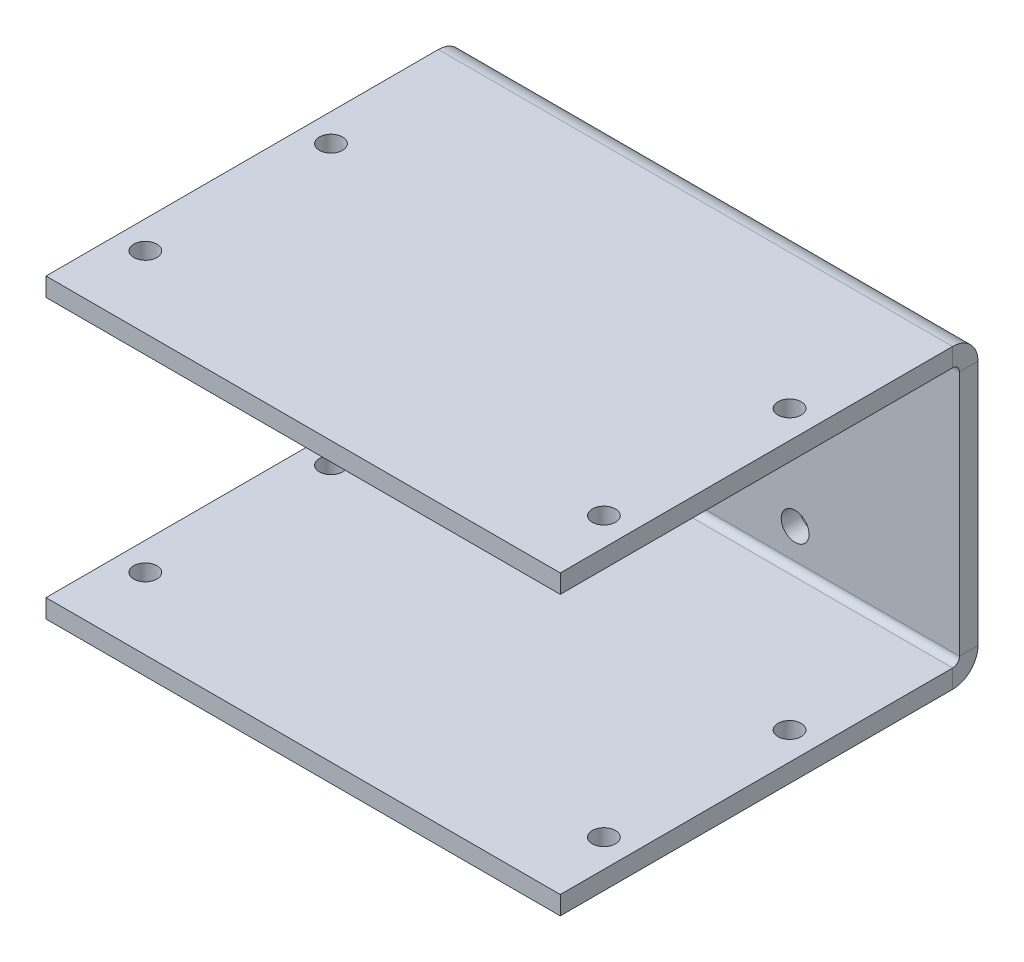
from build123d import *

# Parameters (mm, degrees)
SZKIC1_W                             = 55.4
SZKIC1_H                             = 28
ODGI_CIE_BAZOWE1_DEPTH               = 2
OTWORY_USTALAJ_CE_3_0MM1_D           = 3
OTWORY_USTALAJ_CE_3_0MM1_DEPTH       = 17
OTWORY_USTALAJ_CE_3_0MM1_TIP         = 0.901290929
ODGI_CIE_KRAW_DZI1_STRIP_W           = 9.4732
ODGI_CIE_KRAW_DZI1_STRIP_H           = 2
ODGI_CIE_KRAW_DZI1_STRIP_CUT_DEPTH   = 55.4
ODGI_CIE_KRAW_DZI1_STRIP_2_W         = 9.4732
ODGI_CIE_KRAW_DZI1_STRIP_2_H         = 2
ODGI_CIE_KRAW_DZI1_STRIP_CUT_2_DEPTH = 55.4
ODGI_CIE_KRAW_DZI1_DEPTH             = 55.4
ODGI_CIE_KRAW_DZI1_BEND_DEPTH        = 55.4
OTW_R_GWINTOWANY_M3X0_51_D           = 2.5


# Sheet-metal steps are written as plain solids
with BuildPart() as part:
    # Szkic1 → Odgięcie bazowe1 (new body)
    with BuildSketch(Plane.XY):
        Rectangle(SZKIC1_W, SZKIC1_H)
    extrude(amount=-ODGI_CIE_BAZOWE1_DEPTH)

    # Otwory ustalające Ø3.0mm1
    with Locations(Plane(origin=(0, 0, -2), x_dir=(-1, 0, 0), z_dir=(0, 0, -1))):
        with Locations((-10, 10), (10, 10), (10, -10), (-10, -10)):
            Hole(OTWORY_USTALAJ_CE_3_0MM1_D / 2, depth=OTWORY_USTALAJ_CE_3_0MM1_DEPTH)
            with Locations((0, 0, -(OTWORY_USTALAJ_CE_3_0MM1_DEPTH + OTWORY_USTALAJ_CE_3_0MM1_TIP / 2))):  # 118° drill point
                Cone(0, OTWORY_USTALAJ_CE_3_0MM1_D / 2, OTWORY_USTALAJ_CE_3_0MM1_TIP, mode=Mode.SUBTRACT)

    # Odgięcie krawędzi1 strip (across the edge) → Odgięcie krawędzi1 strip cut (cut)
    with BuildSketch(Plane(origin=(27.7, 14, 0), x_dir=(0, -1, 0), z_dir=(-1, 0, 0))):
        with Locations((-4, -1)):
            Rectangle(ODGI_CIE_KRAW_DZI1_STRIP_W, ODGI_CIE_KRAW_DZI1_STRIP_H)
    extrude(amount=ODGI_CIE_KRAW_DZI1_STRIP_CUT_DEPTH, mode=Mode.SUBTRACT)

    # Odgięcie krawędzi1 strip 2 (across the edge) → Odgięcie krawędzi1 strip cut 2 (cut)
    with BuildSketch(Plane(origin=(-27.7, -14, 0), x_dir=(0, 1, 0), z_dir=(1, 0, 0))):
        with Locations((-4, -1)):
            Rectangle(ODGI_CIE_KRAW_DZI1_STRIP_2_W, ODGI_CIE_KRAW_DZI1_STRIP_2_H)
    extrude(amount=ODGI_CIE_KRAW_DZI1_STRIP_CUT_2_DEPTH, mode=Mode.SUBTRACT)

    # Odgięcie krawędzi1 section (across the edge) → Odgięcie krawędzi1 (add)
    with BuildSketch(Plane(origin=(27.7, 14, 0), x_dir=(0, -1, 0), z_dir=(-1, 0, 0))):
        with BuildLine():
            Line((-2, 0.7366), (-2, 43))
            Line((-2, 43), (0, 43))
            Line((0, 43), (0, 0.7366))
            ThreePointArc((0, 0.7366), (0.215745145, 0.215745145), (0.7366, 0))
            Line((0.7366, 0), (0.7366, -2))
            ThreePointArc((0.7366, -2), (-1.198468417, -1.198468417), (-2, 0.7366))
        make_face()
    extrude(amount=ODGI_CIE_KRAW_DZI1_DEPTH)

    # Odgięcie krawędzi1 section 2 (across the edge) → Odgięcie krawędzi1 bend (add)
    with BuildSketch(Plane(origin=(-27.7, -14, 0), x_dir=(0, 1, 0), z_dir=(1, 0, 0))):
        with BuildLine():
            Line((-2, 0.7366), (-2, 43))
            Line((-2, 43), (0, 43))
            Line((0, 43), (0, 0.7366))
            ThreePointArc((0, 0.7366), (0.215745145, 0.215745145), (0.7366, 0))
            Line((0.7366, 0), (0.7366, -2))
            ThreePointArc((0.7366, -2), (-1.198468417, -1.198468417), (-2, 0.7366))
        make_face()
    extrude(amount=ODGI_CIE_KRAW_DZI1_BEND_DEPTH)

    # Otwór gwintowany M3x0.51 (through all)
    with Locations(Plane(origin=(0, 16, 0), x_dir=(1, 0, 0), z_dir=(0, 1, 0))):
        with Locations((-24.7, -35.3), (-24.7, -15.3), (24.7, -35.3), (24.7, -15.3)):
            Hole(OTW_R_GWINTOWANY_M3X0_51_D / 2)


solid = part.part
